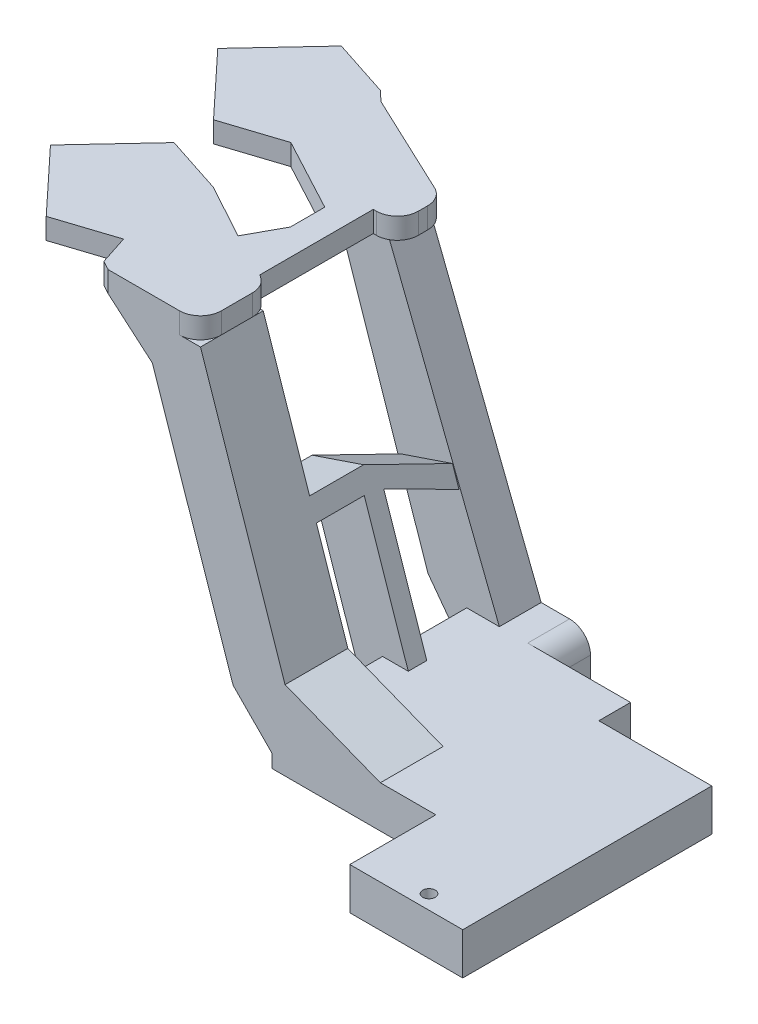
from build123d import *

# Parameters (mm, degrees)
CROQUIS1_R              = 1.5
SALIENTE_EXTRUIR1_DEPTH = 10
SALIENTE_EXTRUIR2_DEPTH = 15
SALIENTE_EXTRUIR3_DEPTH = 13
SALIENTE_EXTRUIR7_DEPTH = 5
REDONDEO2_R             = 10
SALIENTE_EXTRUIR8_DEPTH = 10


with BuildPart() as part:
    # Croquis1 → Saliente-Extruir1 (new body)
    with BuildSketch(Plane(origin=(0, 0, 0), x_dir=(1, 0, 0), z_dir=(0, 1, 0))):
        Polygon((-192.31475004, 37.351943635), (-153.149960772, 37.351943635), (-153.149960772, 29.769862991), (-126.147833027, 29.769862991), (-126.147833027, -29.769862991), (-153.149960772, -29.769862991), (-153.149960772, -9.1952793), (-192.31475004, -9.1952793), align=None)
        with Locations(Location((-137.631197841, -26.344824576, 0), (0, 0, 90))):
            Circle(CROQUIS1_R, mode=Mode.SUBTRACT)
    extrude(amount=SALIENTE_EXTRUIR1_DEPTH)

    # Croquis3 → Saliente-Extruir2 (add)
    with BuildSketch(Plane.XY.offset(9.1952793)):
        Polygon((-189.195504205, 0), (-201.604805992, 12.545329197), (-220.943628409, 69.680078214), (-231.495067756, 78.724169083), (-209.43357333, 78.724169083), (-189.195504205, 18.932679451), (-166.427858451, 10), (-166.427858451, 0), align=None)
    extrude(amount=-SALIENTE_EXTRUIR2_DEPTH)

    # Croquis8 → Saliente-Extruir3 (add)
    with BuildSketch(Plane(origin=(-163.998418841, -55.509761627, 0), x_dir=(0, 0, -1), z_dir=(0.9472114013741786, 0.3206096709501519, 0))):
        Polygon((5.8047207, 107.105877542), (5.8047207, 102.023441322), (17.229529669, 102.023441322), (17.229529669, 62.195551935), (21.649352835, 62.195551935), (21.649352835, 101.235469829), (41.412588148, 92.240137187), (41.412588148, 97.139259402), (18.703552524, 107.105877542), align=None)
    extrude(amount=-SALIENTE_EXTRUIR3_DEPTH)

    # Croquis10 → Saliente-Extruir7 (add)
    with BuildSketch(Plane(origin=(0, 78.724169083, 0), x_dir=(1, 0, 0), z_dir=(0, 1, 0))):
        with BuildLine():
            Line((-249.918671642, 64.972502389), (-235.980528396, 60.431124344))
            Line((-235.980528396, 60.431124344), (-233.719997047, 58.216185839))
            Line((-233.719997047, 58.216185839), (-209.380524185, 46.740483345))
            ThreePointArc((-209.380524185, 46.740483345), (-207.290181053, 44.895496777), (-206.512830069, 42.217954006))
            Line((-206.512830069, 42.217954006), (-206.512830069, 39.966009421))
            ThreePointArc((-206.512830069, 39.966009421), (-207.977296163, 36.430475515), (-211.512830069, 34.966009421))
            Line((-211.512830069, 34.966009421), (-212.273678507, 34.966009421))
            Line((-212.273678507, 34.966009421), (-212.273678507, 7.849044618))
            Line((-212.273678507, 7.849044618), (-211.512568985, 7.30119364))
            ThreePointArc((-211.512568985, 7.30119364), (-209.983572109, 5.522948339), (-209.43357333, 3.243148098))
            Line((-209.43357333, 3.243148098), (-209.43357333, -4.1952793))
            ThreePointArc((-209.43357333, -4.1952793), (-210.898039424, -7.730813206), (-214.43357333, -9.1952793))
            Line((-214.43357333, -9.1952793), (-231.495067756, -9.1952793))
            Line((-231.495067756, -9.1952793), (-233.719997047, -7.977642104))
            Line((-233.719997047, -7.977642104), (-235.980528396, -1.039745845))
            Line((-235.980528396, -1.039745845), (-249.918671642, -5.581123891))
            Line((-249.918671642, -5.581123891), (-264.188355718, 9.695689249))
            Line((-264.188355718, 9.695689249), (-249.918671642, 24.972502389))
            Line((-249.918671642, 24.972502389), (-235.980528396, 20.431124344))
            Line((-235.980528396, 20.431124344), (-222.964320543, 13.307743434))
            Line((-222.964320543, 13.307743434), (-218.531551458, 21.40752702))
            Line((-218.531551458, 21.40752702), (-218.531551458, 29.623801484))
            Line((-218.531551458, 29.623801484), (-235.980528396, 38.960254155))
            Line((-235.980528396, 38.960254155), (-249.918671642, 34.418876109))
            Line((-249.918671642, 34.418876109), (-264.188355718, 49.695689249))
            Line((-264.188355718, 49.695689249), (-249.918671642, 64.972502389))
        make_face()
    extrude(amount=SALIENTE_EXTRUIR7_DEPTH)

    # Redondeo2
    # the kernel refuses this fillet: 10 mm, written as the material it takes off along each edge
    with BuildSketch(Plane(origin=(-196.252662499, -0.765351442, 3.059587863), x_dir=(0.947211401374178, 0.3206096709501537, 0), z_dir=(0, 0, -1))) as redondeo2_piece_1:
        with BuildLine():
            CenterArc((10, -8.115647013), REDONDEO2_R, 125.75091012, 54.24908988)
            Line((0, -8.115647013), (-0.2, -8.115647013))
            Line((-0.2, -8.115647013), (-0.2, 0))
            Line((-0.2, 0), (0, 0.2))
            ThreePointArc((0, 0.2), (2.078687215, 0.2), (4.040521918, 0.16231294))
            Line((4.040521918, 0.16231294), (4.157374429, 0))
        make_face()
    extrude(amount=44.99805823, mode=Mode.SUBTRACT)

    # Croquis13 → Saliente-Extruir8 (add)
    with BuildSketch(Plane(origin=(0, 0, -37.351943635), x_dir=(-1, 0, 0), z_dir=(0, 0, -1))):
        with BuildLine():
            Line((192.31475004, 0), (201.604805992, 12.545329197))
            Line((201.604805992, 12.545329197), (220.943628409, 69.680078214))
            Line((220.943628409, 69.680078214), (227.212441383, 78.145508653))
            Line((227.212441383, 78.145508653), (211.22386426, 78.145508653))
            Line((211.22386426, 78.145508653), (184.515278381, 10))
            Line((184.515278381, 10), (177.732355406, 10))
            ThreePointArc((177.732355406, 10), (174.1968215, 8.535533906), (172.732355406, 5))
            Line((172.732355406, 5), (172.732355406, 0))
            Line((172.732355406, 0), (182.732355406, 0))
            Line((182.732355406, 0), (192.31475004, 0))
        make_face()
    extrude(amount=SALIENTE_EXTRUIR8_DEPTH)


solid = part.part
